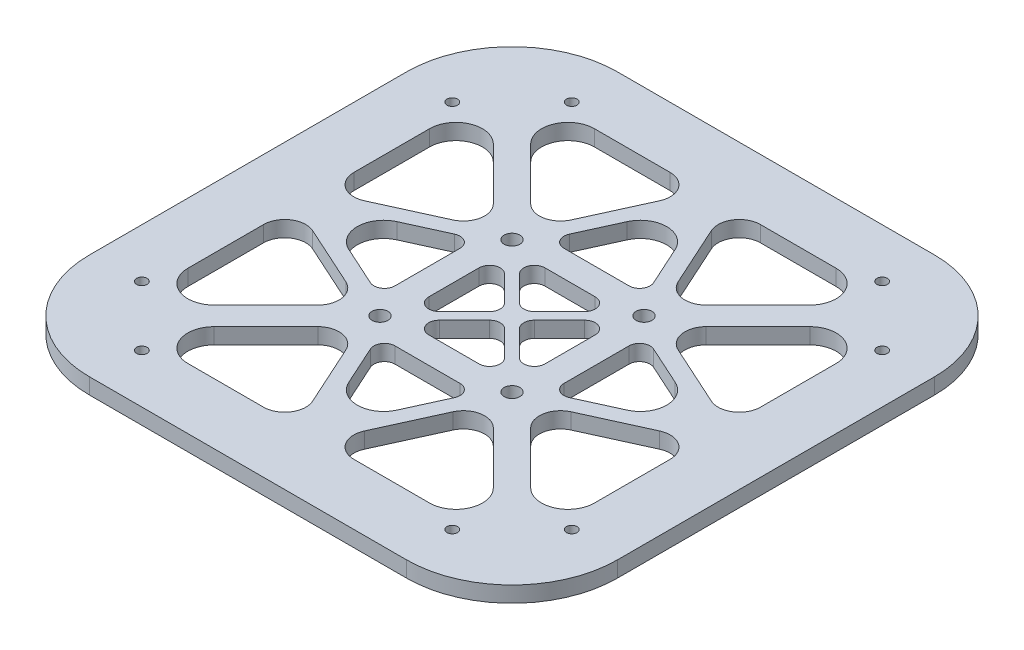
from build123d import *

# Parameters (mm, degrees)
ESQUISSE1_W        = 100
ESQUISSE1_H        = 100
ESQUISSE1_R        = 1.5
ESQUISSE1_R_2      = 1
BOSS_EXTRU_1_DEPTH = 3
CONG_1_R           = 20
CONG_2_R           = 5
CONG_3_R           = 4
CONG_4_R           = 2


with BuildPart() as part:
    # Esquisse1 → Boss.-Extru.1 (new body)
    with BuildSketch(Plane(origin=(0, 0, 0), x_dir=(1, 0, 0), z_dir=(0, 1, 0))):
        Rectangle(ESQUISSE1_W, ESQUISSE1_H)
        with Locations((-12.5, -12.5)):
            Circle(ESQUISSE1_R, mode=Mode.SUBTRACT)
        with Locations((12.5, -12.5)):
            Circle(ESQUISSE1_R, mode=Mode.SUBTRACT)
        with Locations((-12.5, 12.5)):
            Circle(ESQUISSE1_R, mode=Mode.SUBTRACT)
        with Locations((12.5, 12.5)):
            Circle(ESQUISSE1_R, mode=Mode.SUBTRACT)
        with Locations((40.707106781, -29.393398282)):
            Circle(ESQUISSE1_R_2, mode=Mode.SUBTRACT)
        with Locations((29.393398282, -40.707106781)):
            Circle(ESQUISSE1_R_2, mode=Mode.SUBTRACT)
        with Locations((-29.393398282, -40.707106781)):
            Circle(ESQUISSE1_R_2, mode=Mode.SUBTRACT)
        with Locations((-40.707106781, -29.393398282)):
            Circle(ESQUISSE1_R_2, mode=Mode.SUBTRACT)
        with Locations((-40.707106781, 29.393398282)):
            Circle(ESQUISSE1_R_2, mode=Mode.SUBTRACT)
        with Locations((-29.393398282, 40.707106781)):
            Circle(ESQUISSE1_R_2, mode=Mode.SUBTRACT)
        with Locations((29.393398282, 40.707106781)):
            Circle(ESQUISSE1_R_2, mode=Mode.SUBTRACT)
        with Locations((40.707106781, 29.393398282)):
            Circle(ESQUISSE1_R_2, mode=Mode.SUBTRACT)
        Polygon((-9.261402822, -16), (0, -36.375086208), (9.261402822, -16), align=None, mode=Mode.SUBTRACT)
        Polygon((0, -1.414213562), (-9.585786438, -11), (9.585786438, -11), align=None, mode=Mode.SUBTRACT)
        Polygon((-34.964466094, -38.5), (-2.329506269, -38.5), (-12.527931214, -16.06346512), align=None, mode=Mode.SUBTRACT)
        Polygon((34.964466094, -38.5), (2.329506269, -38.5), (12.527931214, -16.06346512), align=None, mode=Mode.SUBTRACT)
        Polygon((-16, 9.261402822), (-36.375086208, 0), (-16, -9.261402822), align=None, mode=Mode.SUBTRACT)
        Polygon((-1.414213562, 0), (-11, 9.585786438), (-11, -9.585786438), align=None, mode=Mode.SUBTRACT)
        Polygon((-38.5, 34.964466094), (-38.5, 2.329506269), (-16.06346512, 12.527931214), align=None, mode=Mode.SUBTRACT)
        Polygon((-38.5, -34.964466094), (-38.5, -2.329506269), (-16.06346512, -12.527931214), align=None, mode=Mode.SUBTRACT)
        Polygon((9.261402822, 16), (0, 36.375086208), (-9.261402822, 16), align=None, mode=Mode.SUBTRACT)
        Polygon((0, 1.414213562), (9.585786438, 11), (-9.585786438, 11), align=None, mode=Mode.SUBTRACT)
        Polygon((34.964466094, 38.5), (2.329506269, 38.5), (12.527931214, 16.06346512), align=None, mode=Mode.SUBTRACT)
        Polygon((-34.964466094, 38.5), (-2.329506269, 38.5), (-12.527931214, 16.06346512), align=None, mode=Mode.SUBTRACT)
        Polygon((16, -9.261402822), (36.375086208, 0), (16, 9.261402822), align=None, mode=Mode.SUBTRACT)
        Polygon((1.414213562, 0), (11, -9.585786438), (11, 9.585786438), align=None, mode=Mode.SUBTRACT)
        Polygon((38.5, -34.964466094), (38.5, -2.329506269), (16.06346512, -12.527931214), align=None, mode=Mode.SUBTRACT)
        Polygon((38.5, 34.964466094), (38.5, 2.329506269), (16.06346512, 12.527931214), align=None, mode=Mode.SUBTRACT)
    extrude(amount=BOSS_EXTRU_1_DEPTH)

    # Congé1
    cong_1_edges = [part.edges().sort_by_distance(p)[0] for p in [
        (-50, 1.5, -50),
        (50, 1.5, -50),
        (50, 1.5, 50),
        (-50, 1.5, 50),
    ]]
    fillet(cong_1_edges, radius=CONG_1_R)

    # Congé2
    cong_2_edges = [part.edges().sort_by_distance(p)[0] for p in [
        (0, 1.5, 36.375086208),
        (36.375086208, 1.5, 0),
        (-36.375086208, 1.5, 0),
        (0, 1.5, -36.375086208),
        (34.964466094, 1.5, 38.5),
        (38.5, 1.5, 34.964466094),
        (38.5, 1.5, -34.964466094),
        (34.964466094, 1.5, -38.5),
        (-34.964466094, 1.5, -38.5),
        (-38.5, 1.5, -34.964466094),
        (-38.5, 1.5, 34.964466094),
        (-34.964466094, 1.5, 38.5),
    ]]
    fillet(cong_2_edges, radius=CONG_2_R)

    # Congé3
    cong_3_edges = [part.edges().sort_by_distance(p)[0] for p in [
        (2.329506269, 1.5, -38.5),
        (-12.527931214, 1.5, -16.06346512),
        (12.527931214, 1.5, -16.06346512),
        (38.5, 1.5, -2.329506269),
        (-2.329506269, 1.5, 38.5),
        (16.06346512, 1.5, -12.527931214),
        (16.06346512, 1.5, 12.527931214),
        (2.329506269, 1.5, 38.5),
        (-2.329506269, 1.5, -38.5),
        (38.5, 1.5, 2.329506269),
        (-16.06346512, 1.5, 12.527931214),
        (12.527931214, 1.5, 16.06346512),
        (-12.527931214, 1.5, 16.06346512),
        (-38.5, 1.5, 2.329506269),
        (-16.06346512, 1.5, -12.527931214),
        (-38.5, 1.5, -2.329506269),
    ]]
    fillet(cong_3_edges, radius=CONG_3_R)

    # Congé4
    cong_4_edges = [part.edges().sort_by_distance(p)[0] for p in [
        (16, 1.5, 9.261402822),
        (9.585786438, 1.5, 11),
        (-9.585786438, 1.5, 11),
        (-9.261402822, 1.5, -16),
        (9.261402822, 1.5, -16),
        (11, 1.5, 9.585786438),
        (9.585786438, 1.5, -11),
        (11, 1.5, -9.585786438),
        (9.261402822, 1.5, 16),
        (1.414213562, 1.5, 0),
        (-9.585786438, 1.5, -11),
        (16, 1.5, -9.261402822),
        (-9.261402822, 1.5, 16),
        (0, 1.5, 1.414213562),
        (-11, 1.5, 9.585786438),
        (-1.414213562, 1.5, 0),
        (-11, 1.5, -9.585786438),
        (-16, 1.5, 9.261402822),
        (-16, 1.5, -9.261402822),
        (0, 1.5, -1.414213562),
    ]]
    fillet(cong_4_edges, radius=CONG_4_R)


solid = part.part
